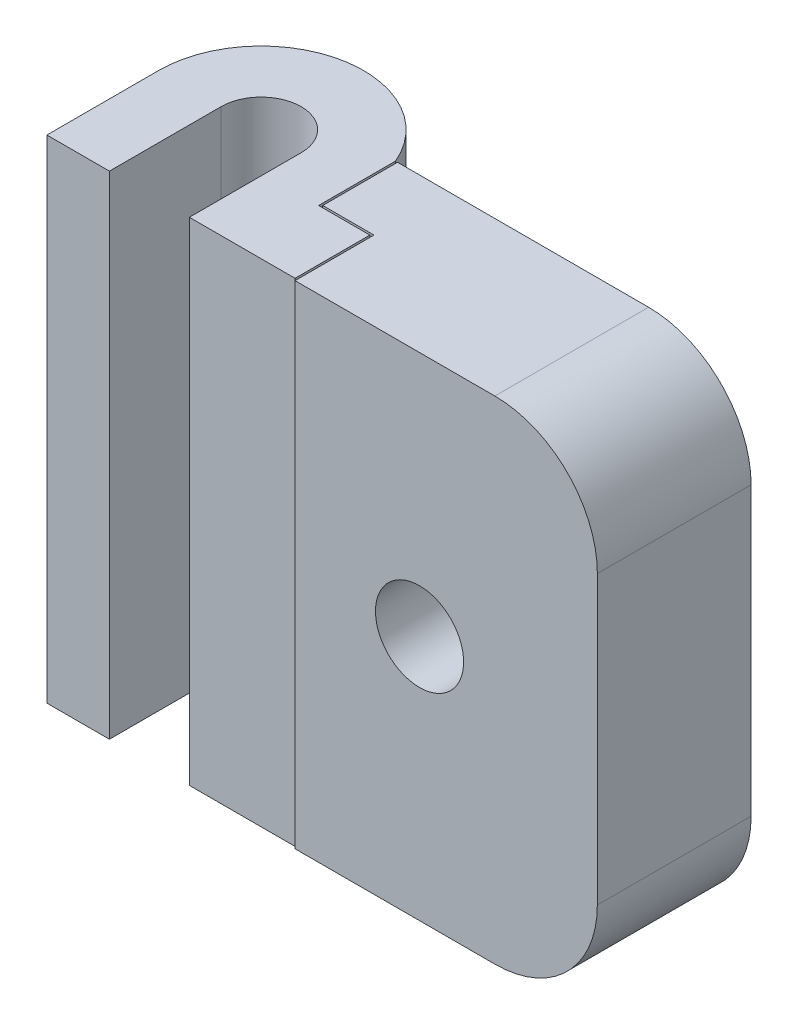
from build123d import *

# Parameters (mm, degrees)
BOSS_EXTRUDE3_DEPTH = 24
FILLET1_R           = 5
SKETCH10_R          = 4.1
CUT_EXTRUDE3_DEPTH  = 3
SKETCH11_R          = 2.15
CUT_EXTRUDE4_DEPTH  = 34.081792575
CUT_EXTRUDE5_DEPTH  = 33.994014609
SKETCH14_W          = 5.154074283
SKETCH14_H          = 24
SKETCH14_W_2        = 3.05
CUT_EXTRUDE6_DEPTH  = 0.1


with BuildPart() as part:
    # Sketch4 → Boss-Extrude3 (new body)
    with BuildSketch(Plane(origin=(0, 0, 0), x_dir=(1, 0, 0), z_dir=(0, 1, 0))):
        with BuildLine():
            Line((21.95, 0), (21.95, 1.95))
            Line((21.95, 1.95), (4.604074283, 1.95))
            ThreePointArc((4.604074283, 1.95), (-0.994894112, 4.90001895), (-5, 0))
            Line((-5, 0), (-5, -5.55))
            Line((-5, -5.55), (-1.95, -5.55))
            Line((-1.95, -5.55), (-1.95, 0))
            ThreePointArc((-1.95, 0), (0, 1.95), (1.95, 0))
            Line((1.95, 0), (1.95, -5.55))
            Line((1.95, -5.55), (21.95, -5.55))
            Line((21.95, -5.55), (21.95, 0))
        make_face()
    extrude(amount=BOSS_EXTRUDE3_DEPTH)

    # Fillet1
    fillet1_edges = [part.edges().sort_by_distance(p)[0] for p in [
        (21.95, 0, 1.8),
        (21.95, 24, 1.8),
    ]]
    fillet(fillet1_edges, radius=FILLET1_R)

    # Sketch10 → Cut-Extrude3 (cut)
    with BuildSketch(Plane(origin=(0, 0, -1.95), x_dir=(-1, 0, 0), z_dir=(0, 0, -1))):
        with Locations((-13.277037141, 12)):
            Circle(SKETCH10_R)
    extrude(amount=-CUT_EXTRUDE3_DEPTH, mode=Mode.SUBTRACT)

    # Sketch11 → Cut-Extrude4 (cut, through all)
    with BuildSketch(Plane(origin=(0, 0, 1.05), x_dir=(-1, 0, 0), z_dir=(0, 0, -1))):
        with Locations((-13.277037141, 12)):
            Circle(SKETCH11_R)
    extrude(amount=-CUT_EXTRUDE4_DEPTH, mode=Mode.SUBTRACT)

    # Sketch13 → Cut-Extrude5 (cut, through all)
    with BuildSketch(Plane.XZ):
        Polygon((4.604074283, -1.95), (4.604074283, 1.8), (7.104074283, 1.8), (7.104074283, 5.55), (7.204074283, 5.55), (7.204074283, 1.7), (4.704074283, 1.7), (4.704074283, -1.95), align=None)
    extrude(amount=-CUT_EXTRUDE5_DEPTH, mode=Mode.SUBTRACT)


with BuildPart() as cut_extrude5_piece_1:
    # of the separate pieces the step leaves, piece 1, a body of its own (cut_extrude5_pieces)
    add(part.part.solids().sort_by_distance((21.95, 5, -1.95))[0])


with BuildPart() as cut_extrude5_piece_2:
    # of the separate pieces the step leaves, piece 2, a body of its own (cut_extrude5_pieces)
    add(part.part.solids().sort_by_distance((4.604074283, 0, -1.95))[0])

    # Sketch14 → Cut-Extrude6 (cut)
    with BuildSketch(Plane.XY.offset(5.55)):
        with Locations((4.527037142, 12)):
            Rectangle(SKETCH14_W, SKETCH14_H)
        with Locations((-3.475, 12)):
            Rectangle(SKETCH14_W_2, SKETCH14_H)
    extrude(amount=-CUT_EXTRUDE6_DEPTH, mode=Mode.SUBTRACT)


solid = Compound([cut_extrude5_piece_1.part, cut_extrude5_piece_2.part])
